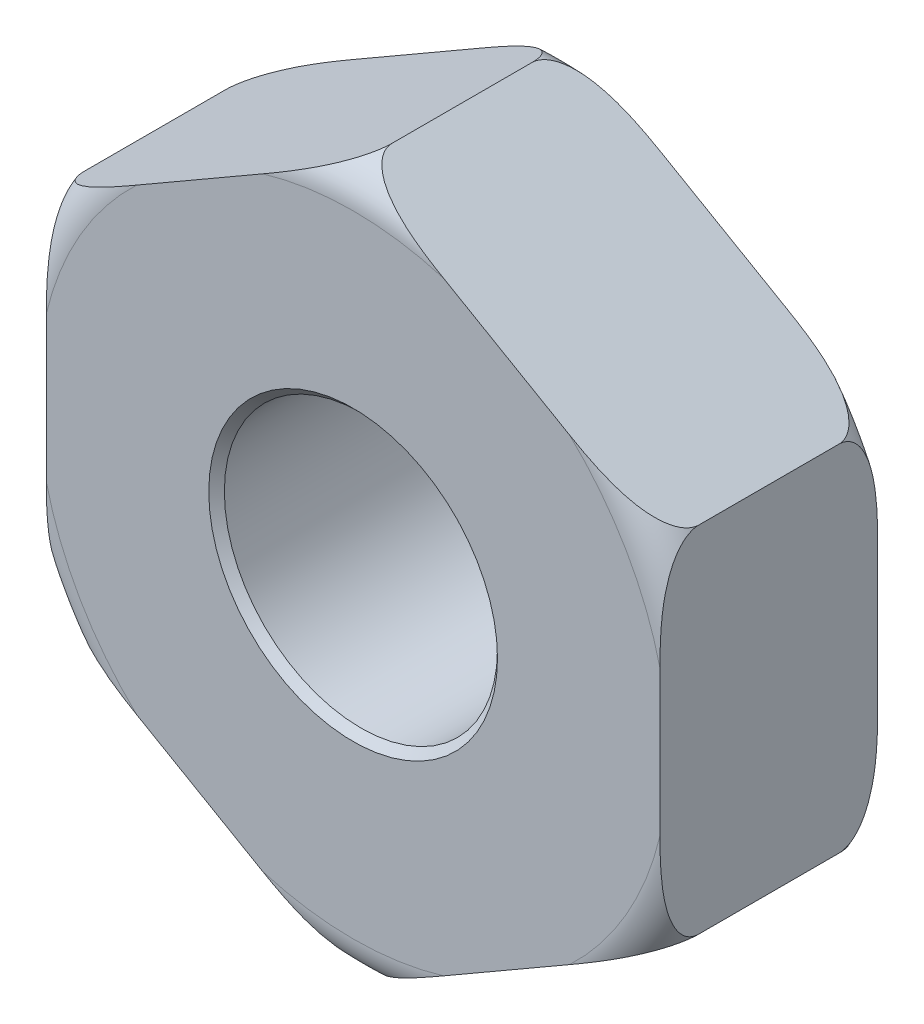
from build123d import *

# Parameters (mm, degrees)
SKETCH1_R          = 1.7525
BASE_EXTRUDE_DEPTH = 1.397


with BuildPart() as part:
    # Sketch1 → Base-Extrude (new, symmetric)
    with BuildSketch(Plane.XY):
        Polygon((0, 4.54605602), (-3.937, 2.27302801), (-3.937, -2.27302801), (0, -4.54605602), (3.937, -2.27302801), (3.937, 2.27302801), align=None)
        Circle(SKETCH1_R, mode=Mode.SUBTRACT)
    extrude(amount=BASE_EXTRUDE_DEPTH, both=True)

    # Sketch2 → DetailCut (revolve, cut)
    with BuildSketch(Plane(origin=(0, 0, 0), x_dir=(0, 0, -1), z_dir=(1, 0, 0))):
        Polygon((-1.397, 1.7525), (-1.397, 1.8525), (-1.297, 1.7525), align=None)
        with BuildLine():
            Line((-1.397, 4.54605602), (-1.397, 4.04605602))
            ThreePointArc((-1.397, 4.04605602), (-1.250553391, 4.39960941), (-0.897, 4.54605602))
            Line((-0.897, 4.54605602), (-1.397, 4.54605602))
        make_face()
        with BuildLine():
            Line((1.397, 4.54605602), (0.897, 4.54605602))
            ThreePointArc((0.897, 4.54605602), (1.250553391, 4.39960941), (1.397, 4.04605602))
            Line((1.397, 4.04605602), (1.397, 4.54605602))
        make_face()
        Polygon((1.297, 1.7525), (1.397, 1.7525), (1.397, 1.8525), align=None)
    revolve(axis=Axis((0, 0, 0), (0, 0, -1)), mode=Mode.SUBTRACT)


solid = part.part
